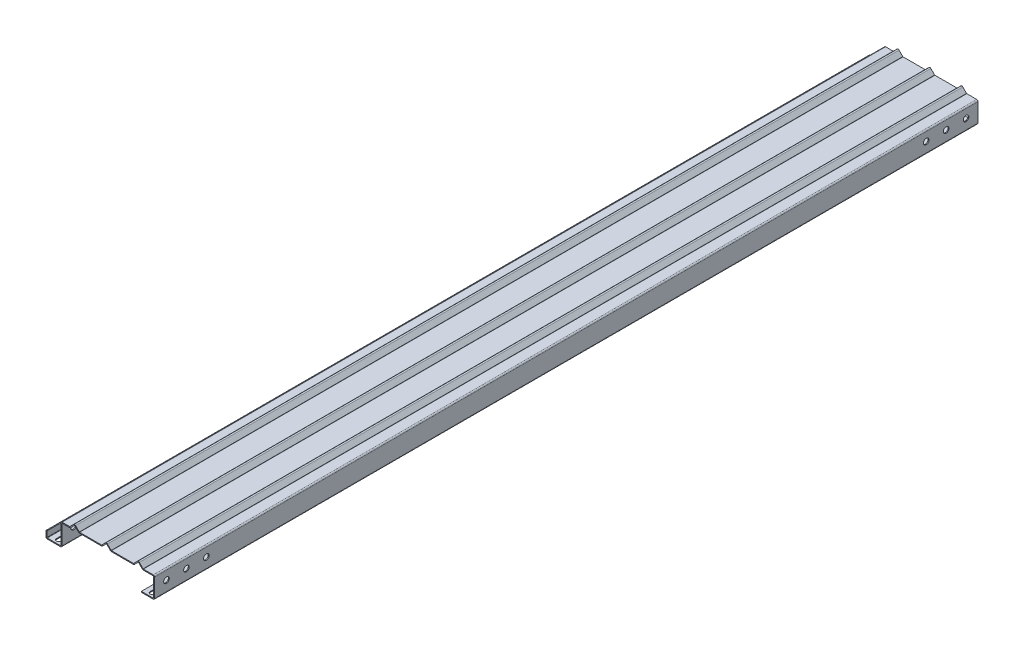
from build123d import *

# Parameters (mm, degrees)
SM_BASE_FLANGE_1_DEPTH = 2066
CUT_EXTRUDE_2_DEPTH    = 2.3
CUT_EXTRUDE_3_REACH    = 2082.367
CUT_EXTRUDE_4_REACH    = 2086.839
SKETCH_8_R             = 7


# Sheet-metal steps are written as plain solids
with BuildPart() as part:
    # Sketch 1 → 基体-法兰1 (new body)
    with BuildSketch(Plane.XY):
        with BuildLine():
            Line((-35, 15), (-35, 1))
            ThreePointArc((-35, 1), (-34.707106781, 0.292893219), (-34, 0))
            Line((-34, 0), (-1, 0))
            ThreePointArc((-1, 0), (-0.292893219, 0.292893219), (0, 1))
            Line((0, 1), (0, 49.7))
            ThreePointArc((0, 49.7), (0.966547622, 52.033452378), (3.3, 53))
            Line((3.3, 53), (22.085786438, 53))
            ThreePointArc((22.085786438, 53), (22.46846987, 53.076120467), (22.792893219, 53.292893219))
            Line((22.792893219, 53.292893219), (32.166547622, 62.666547622))
            ThreePointArc((32.166547622, 62.666547622), (34.5, 63.633095244), (36.833452378, 62.666547622))
            Line((36.833452378, 62.666547622), (46.207106781, 53.292893219))
            ThreePointArc((46.207106781, 53.292893219), (46.53153013, 53.076120467), (46.914213562, 53))
            Line((46.914213562, 53), (102.085786438, 53))
            ThreePointArc((102.085786438, 53), (102.46846987, 53.076120467), (102.792893219, 53.292893219))
            Line((102.792893219, 53.292893219), (112.166547622, 62.666547622))
            ThreePointArc((112.166547622, 62.666547622), (114.5, 63.633095244), (116.833452378, 62.666547622))
            Line((116.833452378, 62.666547622), (126.207106781, 53.292893219))
            ThreePointArc((126.207106781, 53.292893219), (126.53153013, 53.076120467), (126.914213562, 53))
            Line((126.914213562, 53), (182.085786438, 53))
            ThreePointArc((182.085786438, 53), (182.46846987, 53.076120467), (182.792893219, 53.292893219))
            Line((182.792893219, 53.292893219), (192.166547622, 62.666547622))
            ThreePointArc((192.166547622, 62.666547622), (194.5, 63.633095244), (196.833452378, 62.666547622))
            Line((196.833452378, 62.666547622), (206.207106781, 53.292893219))
            ThreePointArc((206.207106781, 53.292893219), (206.53153013, 53.076120467), (206.914213562, 53))
            Line((206.914213562, 53), (231.7, 53))
            ThreePointArc((231.7, 53), (234.033452378, 52.033452378), (235, 49.7))
            Line((235, 49.7), (235, 3.3))
            ThreePointArc((235, 3.3), (234.033452378, 0.966547622), (231.7, 0))
            Line((231.7, 0), (202, 0))
            Line((202, 0), (202, 2.3))
            Line((202, 2.3), (231.7, 2.3))
            ThreePointArc((231.7, 2.3), (232.407106781, 2.592893219), (232.7, 3.3))
            Line((232.7, 3.3), (232.7, 49.7))
            ThreePointArc((232.7, 49.7), (232.407106781, 50.407106781), (231.7, 50.7))
            Line((231.7, 50.7), (206.914213562, 50.7))
            ThreePointArc((206.914213562, 50.7), (205.651358236, 50.951197543), (204.580761184, 51.666547622))
            Line((204.580761184, 51.666547622), (195.207106781, 61.040202025))
            ThreePointArc((195.207106781, 61.040202025), (194.5, 61.333095244), (193.792893219, 61.040202025))
            Line((193.792893219, 61.040202025), (184.419238816, 51.666547622))
            ThreePointArc((184.419238816, 51.666547622), (183.348641764, 50.951197543), (182.085786438, 50.7))
            Line((182.085786438, 50.7), (126.914213562, 50.7))
            ThreePointArc((126.914213562, 50.7), (125.651358236, 50.951197543), (124.580761184, 51.666547622))
            Line((124.580761184, 51.666547622), (115.207106781, 61.040202025))
            ThreePointArc((115.207106781, 61.040202025), (114.5, 61.333095244), (113.792893219, 61.040202025))
            Line((113.792893219, 61.040202025), (104.419238816, 51.666547622))
            ThreePointArc((104.419238816, 51.666547622), (103.348641764, 50.951197543), (102.085786438, 50.7))
            Line((102.085786438, 50.7), (46.914213562, 50.7))
            ThreePointArc((46.914213562, 50.7), (45.651358236, 50.951197543), (44.580761184, 51.666547622))
            Line((44.580761184, 51.666547622), (35.207106781, 61.040202025))
            ThreePointArc((35.207106781, 61.040202025), (34.5, 61.333095244), (33.792893219, 61.040202025))
            Line((33.792893219, 61.040202025), (24.419238816, 51.666547622))
            ThreePointArc((24.419238816, 51.666547622), (23.348641764, 50.951197543), (22.085786438, 50.7))
            Line((22.085786438, 50.7), (3.3, 50.7))
            ThreePointArc((3.3, 50.7), (2.592893219, 50.407106781), (2.3, 49.7))
            Line((2.3, 49.7), (2.3, 1))
            ThreePointArc((2.3, 1), (1.333452378, -1.333452378), (-1, -2.3))
            Line((-1, -2.3), (-34, -2.3))
            ThreePointArc((-34, -2.3), (-36.333452378, -1.333452378), (-37.3, 1))
            Line((-37.3, 1), (-37.3, 15))
            Line((-37.3, 15), (-35, 15))
        make_face()
    extrude(amount=SM_BASE_FLANGE_1_DEPTH)

    # 草图6 → 切除-拉伸2 (cut)
    with BuildSketch(Plane.XZ):
        with BuildLine():
            Line((213.5, 2055.5), (213.5, 2045.5))
            ThreePointArc((213.5, 2045.5), (219, 2040), (224.5, 2045.5))
            Line((224.5, 2045.5), (224.5, 2055.5))
            ThreePointArc((224.5, 2055.5), (219, 2061), (213.5, 2055.5))
        make_face()
    cut_extrude_2 = extrude(amount=-CUT_EXTRUDE_2_DEPTH, mode=Mode.SUBTRACT)

    # 草图7 → 切除-拉伸3 (cut, up to next)
    with BuildSketch(Plane.XZ.offset(2.3), mode=Mode.PRIVATE) as cut_extrude_3_sk1:
        with BuildLine():
            Line((-10.5, 2045.5), (-10.5, 2055.5))
            ThreePointArc((-10.5, 2055.5), (-16, 2061), (-21.5, 2055.5))
            Line((-21.5, 2055.5), (-21.5, 2045.5))
            ThreePointArc((-21.5, 2045.5), (-16, 2040), (-10.5, 2045.5))
        make_face()
    cut_extrude_3_tool1 = extrude(cut_extrude_3_sk1.sketch, amount=-CUT_EXTRUDE_3_REACH, mode=Mode.PRIVATE) & part.part
    cut_extrude_3 = cut_extrude_3_tool1.solids().sort_by_distance((-16, -2.3, 2050.5))[0]
    add(cut_extrude_3, mode=Mode.SUBTRACT)

    # 镜向1: 切除-拉伸2, 切除-拉伸3 across plane
    add(cut_extrude_2.mirror(Plane.XY.offset(1033)), mode=Mode.SUBTRACT)
    add(cut_extrude_3.mirror(Plane.XY.offset(1033)), mode=Mode.SUBTRACT)

    # 切除-拉伸4: up to this face of the body (flat: up to its plane)
    cut_extrude_4_end = Plane(part.part.faces().sort_by_distance((0, 25.35, 1033))[0])
    # 草图8 → 切除-拉伸4 (cut, up to the picked face)
    with BuildSketch(Plane(origin=(235, 0, 0), x_dir=(0, 0, -1), z_dir=(1, 0, 0)), mode=Mode.PRIVATE) as cut_extrude_4_sk1:
        with Locations((-2036, 28)):
            Circle(SKETCH_8_R)
    cut_extrude_4_tool1 = split(extrude(cut_extrude_4_sk1.sketch, amount=-CUT_EXTRUDE_4_REACH, mode=Mode.PRIVATE), bisect_by=cut_extrude_4_end, keep=Keep.BOTH, mode=Mode.PRIVATE)
    # 草图8 → 切除-拉伸4 (cut, up to the picked face)
    with BuildSketch(Plane(origin=(235, 0, 0), x_dir=(0, 0, -1), z_dir=(1, 0, 0)), mode=Mode.PRIVATE) as cut_extrude_4_sk2:
        with Locations((-1986, 28)):
            Circle(SKETCH_8_R)
    cut_extrude_4_tool2 = split(extrude(cut_extrude_4_sk2.sketch, amount=-CUT_EXTRUDE_4_REACH, mode=Mode.PRIVATE), bisect_by=cut_extrude_4_end, keep=Keep.BOTH, mode=Mode.PRIVATE)
    # 草图8 → 切除-拉伸4 (cut, up to the picked face)
    with BuildSketch(Plane(origin=(235, 0, 0), x_dir=(0, 0, -1), z_dir=(1, 0, 0)), mode=Mode.PRIVATE) as cut_extrude_4_sk3:
        with Locations((-1936, 28)):
            Circle(SKETCH_8_R)
    cut_extrude_4_tool3 = split(extrude(cut_extrude_4_sk3.sketch, amount=-CUT_EXTRUDE_4_REACH, mode=Mode.PRIVATE), bisect_by=cut_extrude_4_end, keep=Keep.BOTH, mode=Mode.PRIVATE)
    cut_extrude_4_1 = cut_extrude_4_tool1.solids().sort_by(Axis((235, 28, 2036), (-1, 0, 0)))[0]
    add(cut_extrude_4_1, mode=Mode.SUBTRACT)
    cut_extrude_4_2 = cut_extrude_4_tool2.solids().sort_by(Axis((235, 28, 1986), (-1, 0, 0)))[0]
    add(cut_extrude_4_2, mode=Mode.SUBTRACT)
    cut_extrude_4_3 = cut_extrude_4_tool3.solids().sort_by(Axis((235, 28, 1936), (-1, 0, 0)))[0]
    add(cut_extrude_4_3, mode=Mode.SUBTRACT)
    cut_extrude_4 = cut_extrude_4_1 + cut_extrude_4_2 + cut_extrude_4_3  # 切除-拉伸4 as one shape, for the pattern or mirror that repeats it

    # 镜向2: 切除-拉伸4 across plane
    add(cut_extrude_4.mirror(Plane.XY.offset(1033)), mode=Mode.SUBTRACT)


solid = part.part
